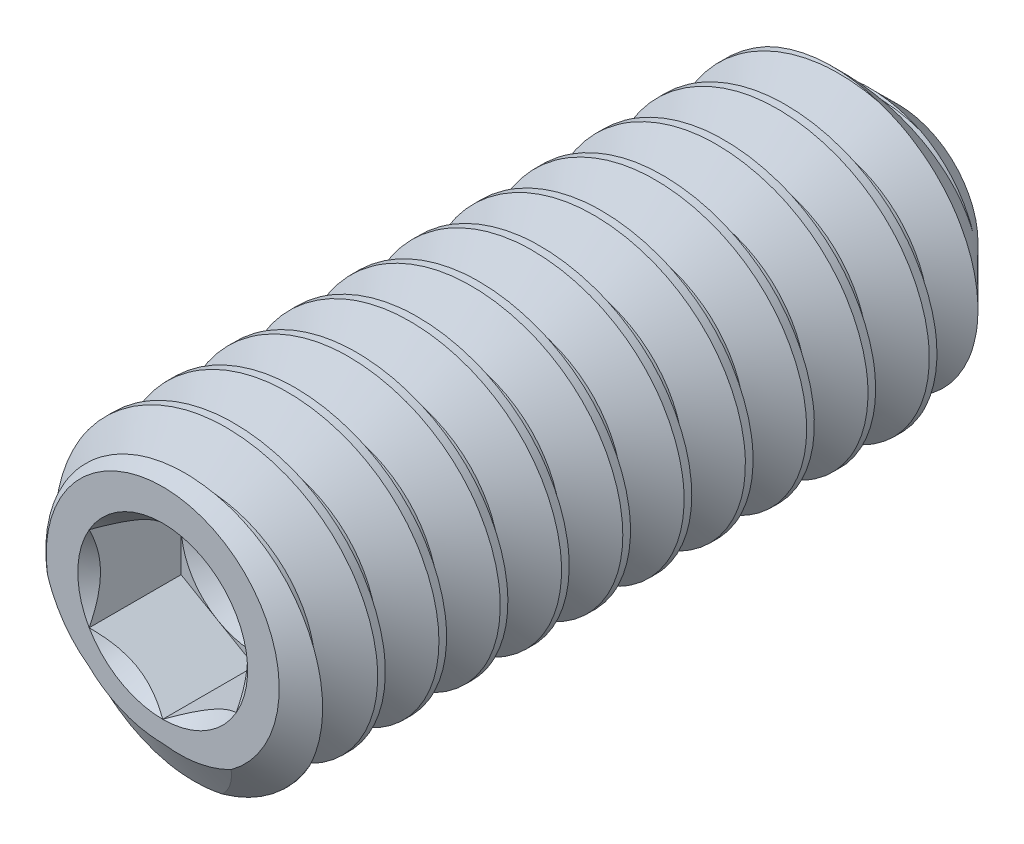
from build123d import *

# Parameters (mm, degrees)
CUT_EXTRUDE10_DEPTH = 0.79375
CUT_SWEEP1_PITCH    = 0.529166667


with BuildPart() as part:
    # Sketch22 → Revolve1 (revolve)
    with BuildSketch(Plane(origin=(0, 0, 0), x_dir=(0, 0, -1), z_dir=(1, 0, 0)), mode=Mode.PRIVATE) as revolve1_sk:
        Polygon((-2.968016653, 0), (-2.968016653, 1.00584), (-2.791942465, 1.2573), (2.813639624, 1.2573), (3.381983347, 0.688956277), (2.968016653, 0), align=None)
    revolve(revolve1_sk.sketch.rotate(Axis((0, 0, -2.968016653), (0, 0, -1)), 180), axis=Axis((0, 0, -2.968016653), (0, 0, -1)))

    # Sketch23 → Cut-Extrude10 (cut)
    with BuildSketch(Plane.XY.offset(2.968016653)):
        Polygon((0, 0.733234842), (-0.635, 0.366617421), (-0.635, -0.366617421), (0, -0.733234842), (0.635, -0.366617421), (0.635, 0.366617421), align=None)
    extrude(amount=-CUT_EXTRUDE10_DEPTH, mode=Mode.SUBTRACT)

    # Cut-Extrude11 cone 1 section (through the dimple's axis) → Cut-Extrude11 (revolve, cut)
    with BuildSketch(Plane(origin=(0, 0, 2.968016653), x_dir=(0, -1, 0), z_dir=(1, 0, 0))):
        Polygon((0, 0), (0.733234842, 0), (0, 0.733234842), align=None)
    revolve(axis=Axis((0, 0, 2.968016653), (0, 0, -1)), mode=Mode.SUBTRACT)

    # Cut-Extrude12 cone 1 section (through the dimple's axis) → Cut-Extrude12 (revolve, cut)
    with BuildSketch(Plane(origin=(0, 0, 2.174266653), x_dir=(0, -1, 0), z_dir=(1, 0, 0))):
        Polygon((0, 0), (0.635, 0), (0, 0.366617421), align=None)
    revolve(axis=Axis((0, 0, 2.174266653), (0, 0, -1)), mode=Mode.SUBTRACT)

    # Cut-Sweep1: the profile of Sketch32 screwed along a right-hand helix of 13 turns, 6 arcs to a turn; built about Z, then put on its axis
    cut_sweep1_z = Axis((0, 0, 0), (0, 0, 1))
    cut_sweep1_corners = [(0.913596168, 0, -0.1984375), (0.913596168, 0, -0.264583333), (1.285941986, 0, -0.479557292), (1.285941986, 0, 0.016536458)]
    with BuildLine(mode=Mode.PRIVATE) as cut_sweep1_profile:
        Line(cut_sweep1_corners[0], cut_sweep1_corners[1])
        Line(cut_sweep1_corners[1], cut_sweep1_corners[2])
        Line(cut_sweep1_corners[2], cut_sweep1_corners[3])
        Line(cut_sweep1_corners[3], cut_sweep1_corners[0])
    cut_sweep1_cap = Face(cut_sweep1_profile.wire())
    cut_sweep1_turn_angles = [0, 30, 60, 90, 120, 150, 180, 210, 240, 270, 300, 330, 360]
    cut_sweep1_turn_weights = [1, 0.8660254037844387, 1, 0.8660254037844387, 1, 0.8660254037844387, 1, 0.8660254037844387, 1, 0.8660254037844387, 1, 0.8660254037844387, 1]
    cut_sweep1_turn_rails = [Edge.make_bspline([Vector(p[0], p[1], 0).rotate(cut_sweep1_z, cut_sweep1_turn_angles[k]) / cut_sweep1_turn_weights[k] + Vector(0, 0, p[2] + CUT_SWEEP1_PITCH * cut_sweep1_turn_angles[k] / 360) for k in range(13)], [0, 0, 0, 1, 1, 2, 2, 3, 3, 4, 4, 5, 5, 6, 6, 6], 2, cut_sweep1_turn_weights) for p in cut_sweep1_corners]
    cut_sweep1_turn_sides = [Face.make_surface_from_curves(cut_sweep1_turn_rails[p[0]], cut_sweep1_turn_rails[p[1]]) for p in [(0, 1), (1, 2), (2, 3), (3, 0)]]
    cut_sweep1 = Plane(origin=(0, 0, -3.381983347), x_dir=(0, 1, 0), z_dir=(0, 0, 1)) * Solid(Shell([*[p.moved(Location((0, 0, CUT_SWEEP1_PITCH * i))) for i in range(13) for p in cut_sweep1_turn_sides], cut_sweep1_cap, cut_sweep1_cap.rotate(cut_sweep1_z, 4680).moved(Location((0, 0, CUT_SWEEP1_PITCH * 4680 / 360)))]))
    add(cut_sweep1, mode=Mode.SUBTRACT)


solid = part.part
